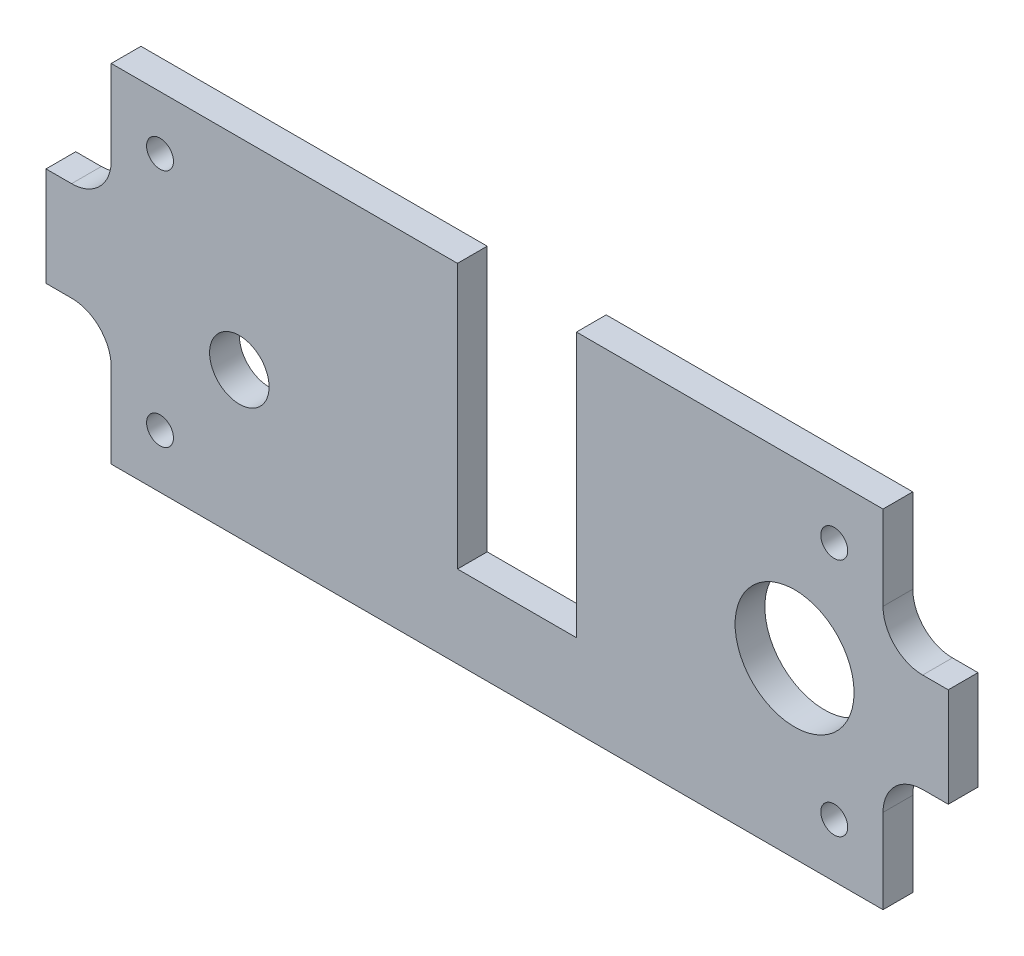
from build123d import *

# Parameters (mm, degrees)
BOSS_EXTRUDE1_DEPTH          = 4.7625
F_3_8_0_375_DIAMETER_HOLE1_D = 9.525
F_3_4_0_75_DIAMETER_HOLE1_D  = 19.05
F_6_CLEARANCE_HOLE1_D        = 4.3053


with BuildPart() as part:
    # Sketch1 → Boss-Extrude1 (new body)
    with BuildSketch(Plane.XY):
        with BuildLine():
            Line((85.725, 56.35625), (85.725, 13.97))
            Line((85.725, 13.97), (66.675, 13.97))
            Line((66.675, 13.97), (66.675, 56.35625))
            Line((66.675, 56.35625), (11.2395, 56.35625))
            Line((11.2395, 56.35625), (11.2395, 42.8625))
            ThreePointArc((11.2395, 42.8625), (9.379628061, 38.372371939), (4.8895, 36.5125))
            Line((4.8895, 36.5125), (0.79375, 36.5125))
            Line((0.79375, 36.5125), (0.79375, 20.6375))
            Line((0.79375, 20.6375), (4.8895, 20.6375))
            ThreePointArc((4.8895, 20.6375), (9.379628061, 18.777628061), (11.2395, 14.2875))
            Line((11.2395, 14.2875), (11.2395, 0.79375))
            Line((11.2395, 0.79375), (134.8105, 0.79375))
            Line((134.8105, 0.79375), (134.8105, 14.2875))
            ThreePointArc((134.8105, 14.2875), (136.670371939, 18.777628061), (141.1605, 20.6375))
            Line((141.1605, 20.6375), (145.25625, 20.6375))
            Line((145.25625, 20.6375), (145.25625, 36.5125))
            Line((145.25625, 36.5125), (141.1605, 36.5125))
            ThreePointArc((141.1605, 36.5125), (136.670371939, 38.372371939), (134.8105, 42.8625))
            Line((134.8105, 42.8625), (134.8105, 56.35625))
            Line((134.8105, 56.35625), (85.725, 56.35625))
        make_face()
    extrude(amount=BOSS_EXTRUDE1_DEPTH)

    # 3/8 (0.375) Diameter Hole1 (through all)
    with Locations(Plane.XY.offset(4.7625)):
        with Locations((31.75, 24.13)):
            Hole(F_3_8_0_375_DIAMETER_HOLE1_D / 2)

    # 3/4 (0.75) Diameter Hole1 (through all)
    with Locations(Plane.XY.offset(4.7625)):
        with Locations((76.2, 28.575), (120.65, 28.575)):
            Hole(F_3_4_0_75_DIAMETER_HOLE1_D / 2)

    # #6 Clearance Hole1 (through all)
    with Locations(Plane.XY.offset(4.7625)):
        with Locations((19.05, 9.398), (19.05, 47.752), (127, 47.752), (127, 9.398)):
            Hole(F_6_CLEARANCE_HOLE1_D / 2)


solid = part.part
